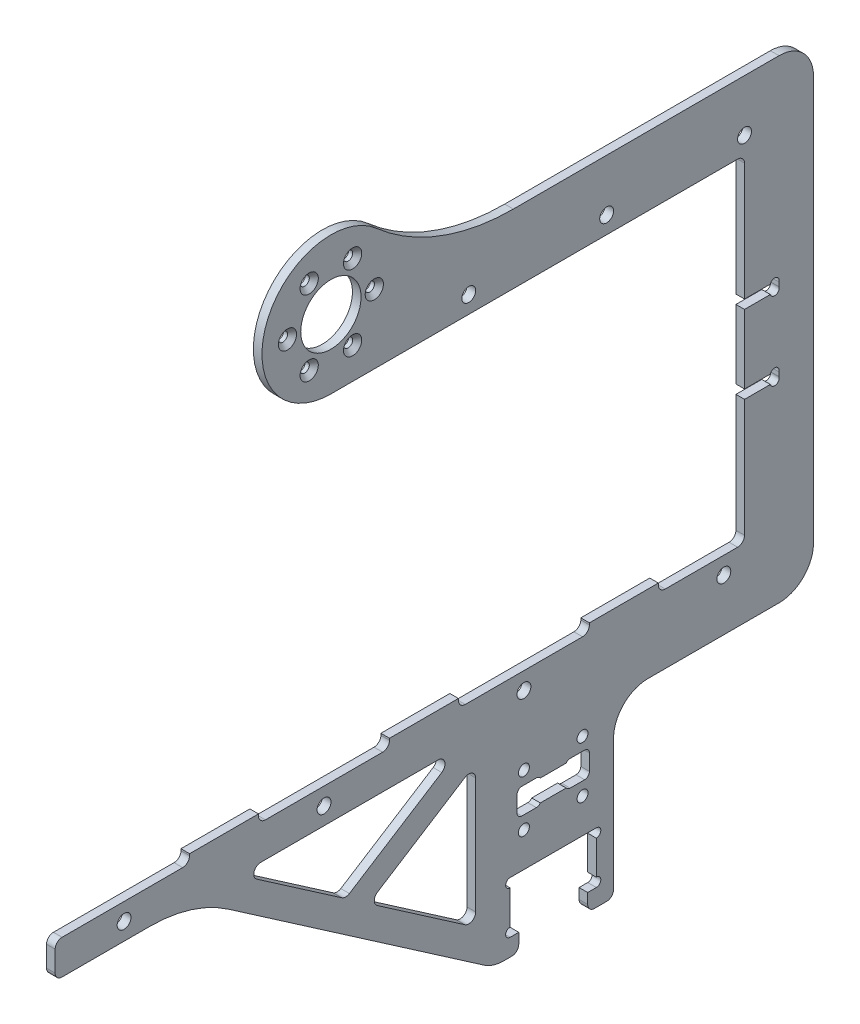
from build123d import *

# Parameters (mm, degrees)
BASE_FLANGE1_DEPTH           = 3.175
SKETCH8_W                    = 12.7
SKETCH8_H                    = 3.302
CUT_EXTRUDE2_DEPTH           = 318.51984313
SKETCH11_R                   = 3.175
CUT_EXTRUDE4_DEPTH           = 318.51984313
SKETCH21_R                   = 2.5527
CUT_EXTRUDE5_DEPTH           = 318.51984313
SKETCH23_W                   = 25.4
SKETCH23_H                   = 3.175
TAB1_DEPTH                   = 3.175
CSK_FOR_M3_SFHCS1_AT_2_COUNT = 2
CSK_FOR_M3_SFHCS1_AT_2_PITCH = 16
CSK_FOR_M3_SFHCS1_AT_3_COUNT = 2
CSK_FOR_M3_SFHCS1_AT_3_PITCH = 27.712812921
CSK_FOR_M3_SFHCS1_AT_4_COUNT = 2
CSK_FOR_M3_SFHCS1_AT_4_PITCH = 32
CSK_FOR_M3_SFHCS1_AT_5_COUNT = 2
CSK_FOR_M3_SFHCS1_AT_5_PITCH = 27.712812921
CSK_FOR_M3_SFHCS1_AT_6_COUNT = 2
CSK_FOR_M3_SFHCS1_AT_6_PITCH = 16
SKETCH27_R                   = 2.0193
CUT_EXTRUDE6_DEPTH           = 318.51984313
CUT_EXTRUDE8_DEPTH           = 318.51984313
FILLET2_R                    = 12.7
SKETCH29_R                   = 11.1125
CUT_EXTRUDE9_DEPTH           = 318.51984313
BREAK_CORNER1_START          = -3.175
BREAK_CORNER1_DEPTH          = 3.175
FILLET1_R                    = 2.54
FILLET4_R                    = 50.8
CUT_EXTRUDE10_DEPTH          = 318.51984313
FILLET5_R                    = 2.54


# Read off the part's stored shape, not the designer's step: Break-Corner1
# Sheet-metal steps are written as plain solids
with BuildPart() as part:
    # Sketch1 → Base-Flange1 (new body)
    with BuildSketch(Plane(origin=(0, 0, 0), x_dir=(0, 0, -1), z_dir=(1, 0, 0))):
        with BuildLine():
            Line((0, -87.3125), (0, 87.3125))
            Line((0, 87.3125), (-110.597916699, 87.3125))
            ThreePointArc((-110.597916699, 87.3125), (-137.538685062, 92.233926782), (-160.999479175, 106.3625))
            ThreePointArc((-160.999479175, 106.3625), (-201.559524406, 96.292756121), (-177.8, 61.9125))
            Line((-177.8, 61.9125), (-25.4, 61.9125))
            Line((-25.4, 61.9125), (-25.4, -61.9125))
            Line((-25.4, -61.9125), (-279.4, -61.9125))
            Line((-279.4, -61.9125), (-279.4, -74.6125))
            Line((-279.4, -74.6125), (-228.6, -74.6125))
            Line((-228.6, -74.6125), (-118.11, -150.8125))
            Line((-118.11, -150.8125), (-108.585, -150.8125))
            Line((-108.585, -150.8125), (-108.585, -144.4625))
            Line((-108.585, -144.4625), (-111.76, -144.4625))
            Line((-111.76, -144.4625), (-111.76, -125.4125))
            Line((-111.76, -125.4125), (-80.01, -125.4125))
            Line((-80.01, -125.4125), (-80.01, -144.4625))
            Line((-80.01, -144.4625), (-83.185, -144.4625))
            Line((-83.185, -144.4625), (-83.185, -150.8125))
            Line((-83.185, -150.8125), (-73.66, -150.8125))
            Line((-73.66, -150.8125), (-73.66, -100.0125))
            ThreePointArc((-73.66, -100.0125), (-69.940256121, -91.032243879), (-60.96, -87.3125))
            Line((-60.96, -87.3125), (0, -87.3125))
        make_face()
    extrude(amount=-BASE_FLANGE1_DEPTH)

    # Sketch8 → Cut-Extrude2 (cut, through all)
    with BuildSketch(Plane(origin=(0, 0, 0), x_dir=(0, 0, -1), z_dir=(1, 0, 0))):
        with Locations((-19.05, 14.351)):
            Rectangle(SKETCH8_W, SKETCH8_H)
        with Locations((-19.05, -14.351)):
            Rectangle(SKETCH8_W, SKETCH8_H)
    extrude(amount=-CUT_EXTRUDE2_DEPTH, mode=Mode.SUBTRACT)

    # Sketch11 → Cut-Extrude4 (cut, through all)
    with BuildSketch(Plane(origin=(0, 0, 0), x_dir=(0, 0, -1), z_dir=(1, 0, 0))):
        with Locations((-177.8, 87.3125)):
            Circle(SKETCH11_R)
    extrude(amount=-CUT_EXTRUDE4_DEPTH, mode=Mode.SUBTRACT)

    # Sketch21 → Cut-Extrude5 (cut, through all)
    with BuildSketch(Plane(origin=(0, 0, 0), x_dir=(0, 0, -1), z_dir=(1, 0, 0))):
        with Locations((-33.02, -68.2625)):
            Circle(SKETCH21_R)
        with Locations((-106.68, -68.2625)):
            Circle(SKETCH21_R)
        with Locations((-180.34, -68.2625)):
            Circle(SKETCH21_R)
        with Locations((-254, -68.2625)):
            Circle(SKETCH21_R)
        with Locations((-25.4, 68.2625)):
            Circle(SKETCH21_R)
        with Locations((-76.2, 68.2625)):
            Circle(SKETCH21_R)
        with Locations((-127, 68.2625)):
            Circle(SKETCH21_R)
    extrude(amount=-CUT_EXTRUDE5_DEPTH, mode=Mode.SUBTRACT)

    # Sketch23 → Tab1 (add)
    with BuildSketch(Plane(origin=(0, 0, 0), x_dir=(0, 0, -1), z_dir=(1, 0, 0))):
        with Locations((-217.17, -60.325)):
            Rectangle(SKETCH23_W, SKETCH23_H)
        with Locations((-143.51, -60.325)):
            Rectangle(SKETCH23_W, SKETCH23_H)
        with Locations((-69.85, -60.325)):
            Rectangle(SKETCH23_W, SKETCH23_H)
    extrude(amount=-TAB1_DEPTH)

    # Sketch25 → CSK for M3 SFHCS1 (revolve, cut)
    with BuildSketch(Plane(origin=(0, 87.3125, 161.8), x_dir=(0, 0, -1), z_dir=(0, 1, 0))):
        Polygon((0, 0), (0, 3.175), (1.7, 3.175), (1.7, 1.66), (3.36, 0), align=None)
    csk_for_m3_sfhcs1 = revolve(axis=Axis((6.35, 87.3125, 161.8), (-1, 0, 0)), mode=Mode.SUBTRACT)

    # CSK for M3 SFHCS1 at 2: CSK for M3 SFHCS1 ×2
    with Locations(*[Vector(0, -0.8660254037844383, 0.5000000000000007) * (i * CSK_FOR_M3_SFHCS1_AT_2_PITCH) for i in range(1, CSK_FOR_M3_SFHCS1_AT_2_COUNT)]):
        add(csk_for_m3_sfhcs1, mode=Mode.SUBTRACT)

    # CSK for M3 SFHCS1 at 3: CSK for M3 SFHCS1 ×2
    with Locations(*[Vector(0, -0.5000000000000007, 0.8660254037844384) * (i * CSK_FOR_M3_SFHCS1_AT_3_PITCH) for i in range(1, CSK_FOR_M3_SFHCS1_AT_3_COUNT)]):
        add(csk_for_m3_sfhcs1, mode=Mode.SUBTRACT)

    # CSK for M3 SFHCS1 at 4: CSK for M3 SFHCS1 ×2
    with Locations(*[(0, 0, i * CSK_FOR_M3_SFHCS1_AT_4_PITCH) for i in range(1, CSK_FOR_M3_SFHCS1_AT_4_COUNT)]):
        add(csk_for_m3_sfhcs1, mode=Mode.SUBTRACT)

    # CSK for M3 SFHCS1 at 5: CSK for M3 SFHCS1 ×2
    with Locations(*[Vector(0, 0.500000000000001, 0.866025403784438) * (i * CSK_FOR_M3_SFHCS1_AT_5_PITCH) for i in range(1, CSK_FOR_M3_SFHCS1_AT_5_COUNT)]):
        add(csk_for_m3_sfhcs1, mode=Mode.SUBTRACT)

    # CSK for M3 SFHCS1 at 6: CSK for M3 SFHCS1 ×2
    with Locations(*[Vector(0, 0.8660254037844392, 0.49999999999999917) * (i * CSK_FOR_M3_SFHCS1_AT_6_PITCH) for i in range(1, CSK_FOR_M3_SFHCS1_AT_6_COUNT)]):
        add(csk_for_m3_sfhcs1, mode=Mode.SUBTRACT)

    # Sketch27 → Cut-Extrude6 (cut, through all)
    with BuildSketch(Plane(origin=(0, 0, 0), x_dir=(0, 0, -1), z_dir=(1, 0, 0))):
        with Locations((-85.09, -93.6625)):
            Circle(SKETCH27_R)
        with Locations(Location((-85.09, -112.7125, 0), (0, 0, 180))):
            Circle(SKETCH27_R)
        with Locations((-106.68, -112.7125)):
            Circle(SKETCH27_R)
        with Locations(Location((-106.68, -93.6625, 0), (0, 0, 180))):
            Circle(SKETCH27_R)
        with BuildLine():
            Line((-107.442, -98.45675), (-102.106618912, -98.45675))
            ThreePointArc((-102.106618912, -98.45675), (-101.283564844, -98.658721447), (-100.6475, -99.21875))
            Line((-100.6475, -99.21875), (-91.1225, -99.21875))
            ThreePointArc((-91.1225, -99.21875), (-90.486435156, -98.658721447), (-89.663381088, -98.45675))
            Line((-89.663381088, -98.45675), (-84.328, -98.45675))
            ThreePointArc((-84.328, -98.45675), (-83.070764143, -98.977514143), (-82.55, -100.23475))
            Line((-82.55, -100.23475), (-82.55, -106.14025))
            ThreePointArc((-82.55, -106.14025), (-83.070764143, -107.397485857), (-84.328, -107.91825))
            Line((-84.328, -107.91825), (-89.663381088, -107.91825))
            ThreePointArc((-89.663381088, -107.91825), (-90.486435156, -107.716278553), (-91.1225, -107.15625))
            Line((-91.1225, -107.15625), (-100.6475, -107.15625))
            ThreePointArc((-100.6475, -107.15625), (-101.283564844, -107.716278553), (-102.106618912, -107.91825))
            Line((-102.106618912, -107.91825), (-107.442, -107.91825))
            ThreePointArc((-107.442, -107.91825), (-108.699235857, -107.397485857), (-109.22, -106.14025))
            Line((-109.22, -106.14025), (-109.22, -100.23475))
            ThreePointArc((-109.22, -100.23475), (-108.699235857, -98.977514143), (-107.442, -98.45675))
        make_face()
    extrude(amount=-CUT_EXTRUDE6_DEPTH, mode=Mode.SUBTRACT)

    # Sketch28 → Cut-Extrude8 (cut, through all)
    with BuildSketch(Plane(origin=(0, 0, 0), x_dir=(0, 0, -1), z_dir=(1, 0, 0))):
        with BuildLine():
            Line((-111.76, -144.4625), (-111.76, -141.1605))
            ThreePointArc((-111.76, -141.1605), (-113.411, -142.8115), (-111.76, -144.4625))
        make_face()
        with BuildLine():
            Line((-80.01, -144.4625), (-80.01, -141.1605))
            ThreePointArc((-80.01, -141.1605), (-78.359, -142.8115), (-80.01, -144.4625))
        make_face()
        with BuildLine():
            Line((-80.01, -125.4125), (-80.01, -128.7145))
            ThreePointArc((-80.01, -128.7145), (-78.359, -127.0635), (-80.01, -125.4125))
        make_face()
        with BuildLine():
            Line((-111.76, -125.4125), (-111.76, -128.7145))
            ThreePointArc((-111.76, -128.7145), (-113.411, -127.0635), (-111.76, -125.4125))
        make_face()
        with BuildLine():
            ThreePointArc((-15.41705117, -14.351), (-14.290037971, -17.2085), (-13.163024773, -14.351))
            ThreePointArc((-13.163024773, -14.351), (-14.290037971, -11.4935), (-15.41705117, -14.351))
        make_face()
        with BuildLine():
            ThreePointArc((-15.41705117, 14.351), (-14.290037971, 11.4935), (-13.163024773, 14.351))
            ThreePointArc((-13.163024773, 14.351), (-14.290037971, 17.2085), (-15.41705117, 14.351))
        make_face()
    extrude(amount=-CUT_EXTRUDE8_DEPTH, mode=Mode.SUBTRACT)

    # Fillet2
    fillet2_edges = [part.edges().sort_by_distance(p)[0] for p in [
        (-1.5875, -87.3125, 0),
        (-1.5875, -150.8125, 118.11),
    ]]
    fillet(fillet2_edges, radius=FILLET2_R)

    # Sketch29 → Cut-Extrude9 (cut, through all)
    with BuildSketch(Plane.ZY.offset(3.175)):
        with Locations((177.8, 87.3125)):
            Circle(SKETCH29_R)
    extrude(amount=-CUT_EXTRUDE9_DEPTH, mode=Mode.SUBTRACT)

    # Break-Corner1 outline → Break-Corner1 (cut)
    with BuildSketch(Plane.YZ.offset(BREAK_CORNER1_START)):
        with BuildLine():
            ThreePointArc((87.3125, 12.7), (83.592756121, 3.719743879), (74.6125, 0))
            Line((74.6125, 0), (87.3125, 0))
            Line((87.3125, 0), (87.3125, 12.7))
        make_face()
    extrude(amount=BREAK_CORNER1_DEPTH, mode=Mode.SUBTRACT)

    # Fillet1
    fillet1_edges = [part.edges().sort_by_distance(p)[0] for p in [
        (-1.5875, -61.9125, 229.87),
        (-1.5875, -61.9125, 204.47),
        (-1.5875, -61.9125, 156.21),
        (-1.5875, -61.9125, 130.81),
        (-1.5875, -61.9125, 82.55),
        (-1.5875, -61.9125, 57.15),
        (-1.5875, -150.8125, 73.66),
        (-1.5875, -150.8125, 83.185),
        (-1.5875, -150.8125, 108.585),
        (-1.5875, -74.6125, 279.4),
        (-1.5875, -61.9125, 279.4),
        (-1.5875, -61.9125, 25.4),
        (-1.5875, 61.9125, 25.4),
    ]]
    fillet(fillet1_edges, radius=FILLET1_R)

    # Fillet4
    fillet4_edges = [part.edges().sort_by_distance(p)[0] for p in [
        (-1.5875, -74.6125, 228.6),
    ]]
    fillet(fillet4_edges, radius=FILLET4_R)

    # Sketch30 → Cut-Extrude10 (cut, through all)
    with BuildSketch(Plane.ZY.offset(3.175)):
        Polygon((124.46, -134.86266966), (163.882081016, -107.67502758), (124.46, -82.654490572), align=None)
        Polygon((211.822746006, -74.6125), (129.564117224, -74.6125), (172.400664991, -101.80014208), align=None)
    extrude(amount=-CUT_EXTRUDE10_DEPTH, mode=Mode.SUBTRACT)

    # Fillet5
    fillet5_edges = [part.edges().sort_by_distance(p)[0] for p in [
        (-1.5875, -74.6125, 211.822746006),
        (-1.5875, -101.80014208, 172.400664991),
        (-1.5875, -74.6125, 129.564117224),
        (-1.5875, -134.86266966, 124.46),
        (-1.5875, -82.654490572, 124.46),
        (-1.5875, -107.67502758, 163.882081016),
    ]]
    fillet(fillet5_edges, radius=FILLET5_R)


solid = part.part
